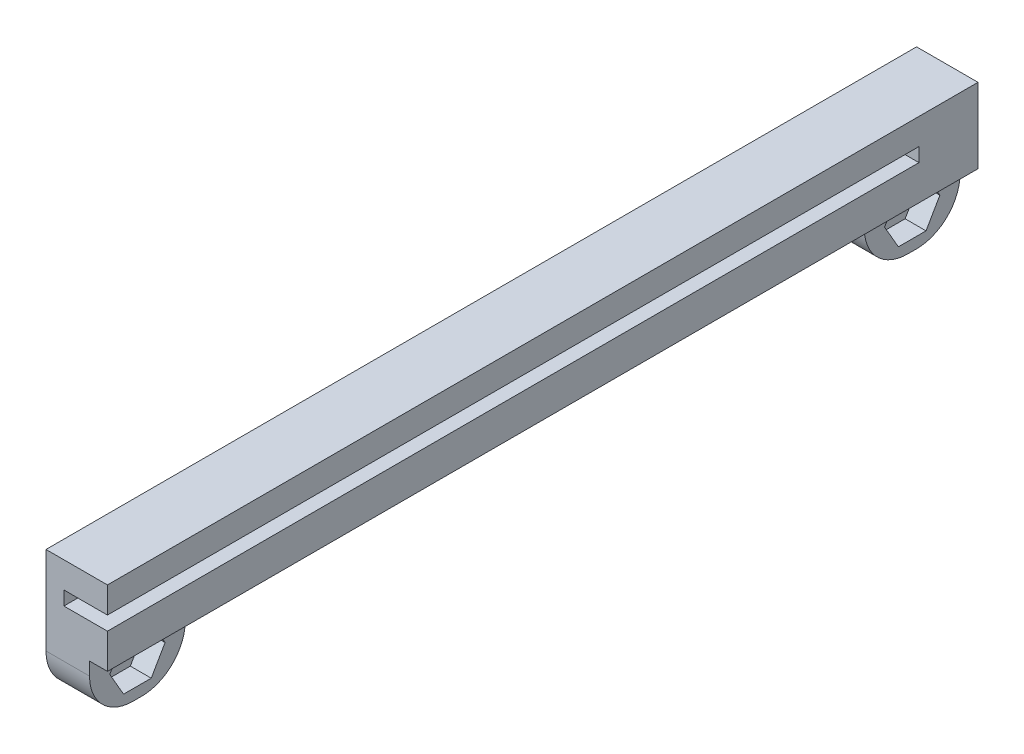
from build123d import *

# Parameters (mm, degrees)
SKETCH1_W           = 7.0575
SKETCH1_H           = 100
BOSS_EXTRUDE2_DEPTH = 7.6
SKETCH4_W           = 5
SKETCH4_H           = 93.218
CUT_EXTRUDE1_DEPTH  = 4.6
SKETCH6_W           = 5
SKETCH6_H           = 93.218
BOSS_EXTRUDE3_DEPTH = 3
SKETCH8_W           = 7.0575
SKETCH8_H           = 100
BOSS_EXTRUDE4_DEPTH = 1
SKETCH9_W           = 5
SKETCH9_H           = 11
BOSS_EXTRUDE5_DEPTH = 6.5
CUT_EXTRUDE2_DEPTH  = 2.4
SKETCH11_R          = 1.5
CUT_EXTRUDE3_DEPTH  = 51.77035854
FILLET2_R           = 5


with BuildPart() as part:
    # Sketch1 → Boss-Extrude2 (new body)
    with BuildSketch(Plane(origin=(0, 0, 0), x_dir=(1, 0, 0), z_dir=(0, 1, 0))):
        Rectangle(SKETCH1_W, SKETCH1_H)
    extrude(amount=BOSS_EXTRUDE2_DEPTH)

    # Sketch4 → Cut-Extrude1 (cut)
    with BuildSketch(Plane(origin=(0, 7.6, 0), x_dir=(1, 0, 0), z_dir=(0, 1, 0))):
        with Locations((1.02875, -3.391)):
            Rectangle(SKETCH4_W, SKETCH4_H)
    extrude(amount=-CUT_EXTRUDE1_DEPTH, mode=Mode.SUBTRACT)

    # Sketch6 → Boss-Extrude3 (add)
    with BuildSketch(Plane(origin=(0, 7.6, 0), x_dir=(1, 0, 0), z_dir=(0, 1, 0))):
        with Locations((1.02875, -3.391)):
            Rectangle(SKETCH6_W, SKETCH6_H)
    extrude(amount=-BOSS_EXTRUDE3_DEPTH)

    # Sketch8 → Boss-Extrude4 (add)
    with BuildSketch(Plane.XZ):
        Rectangle(SKETCH8_W, SKETCH8_H)
    extrude(amount=BOSS_EXTRUDE4_DEPTH)

    # Sketch9 → Boss-Extrude5 (add)
    with BuildSketch(Plane.XZ.offset(1)):
        with Locations((-1.02875, 44.5)):
            Rectangle(SKETCH9_W, SKETCH9_H)
        with Locations((-1.02875, -44.5)):
            Rectangle(SKETCH9_W, SKETCH9_H)
    extrude(amount=BOSS_EXTRUDE5_DEPTH)

    # Sketch10 → Cut-Extrude2 (cut)
    with BuildSketch(Plane(origin=(1.47125, 0, 0), x_dir=(0, 0, -1), z_dir=(1, 0, 0))):
        Polygon((-46.08771324, -0.75), (-47.675426481, -3.5), (-46.08771324, -6.25), (-42.91228676, -6.25), (-41.324573519, -3.5), (-42.91228676, -0.75), align=None)
        Polygon((47.675426481, -3.5), (46.08771324, -0.75), (42.91228676, -0.75), (41.324573519, -3.5), (42.91228676, -6.25), (46.08771324, -6.25), align=None)
    extrude(amount=-CUT_EXTRUDE2_DEPTH, mode=Mode.SUBTRACT)

    # Sketch11 → Cut-Extrude3 (cut, through all)
    with BuildSketch(Plane(origin=(-0.92875, 0, 0), x_dir=(0, 0, -1), z_dir=(1, 0, 0))):
        with Locations((-44.5, -3.5)):
            Circle(SKETCH11_R)
        with Locations((44.5, -3.5)):
            Circle(SKETCH11_R)
    extrude(amount=-CUT_EXTRUDE3_DEPTH, mode=Mode.SUBTRACT)

    # Fillet2
    fillet2_edges = [part.edges().sort_by_distance(p)[0] for p in [
        (-1.02875, -7.5, -50),
        (-1.02875, -7.5, -39),
        (-1.02875, -7.5, 39),
        (-1.02875, -7.5, 50),
    ]]
    fillet(fillet2_edges, radius=FILLET2_R)


solid = part.part
